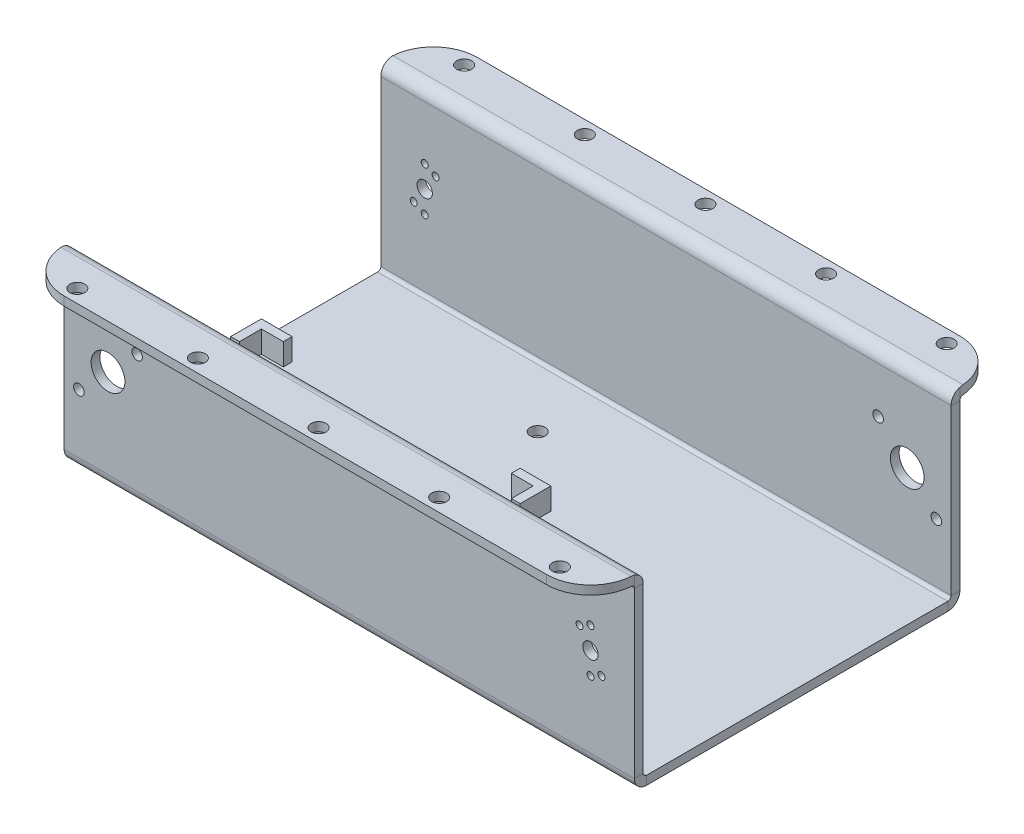
from build123d import *

# Parameters (mm, degrees)
SKETCH_1_W                         = 130
SKETCH_1_H                         = 74.2
SM_BASE_FLANGE_1_DEPTH             = 2
SM_EDGE_FLANGE_1_STRIP_W           = 9.4732
SM_EDGE_FLANGE_1_STRIP_H           = 2
SM_EDGE_FLANGE_1_STRIP_CUT_DEPTH   = 130
SM_EDGE_FLANGE_1_STRIP_2_W         = 9.4732
SM_EDGE_FLANGE_1_STRIP_2_H         = 2
SM_EDGE_FLANGE_1_STRIP_CUT_2_DEPTH = 130
SM_EDGE_FLANGE_1_DEPTH             = 130
SM_EDGE_FLANGE_1_BEND_DEPTH        = 130
SM_EDGE_FLANGE_2_STRIP_W           = 9.4732
SM_EDGE_FLANGE_2_STRIP_H           = 2
SM_EDGE_FLANGE_2_STRIP_CUT_DEPTH   = 130
SM_EDGE_FLANGE_2_STRIP_2_W         = 9.4732
SM_EDGE_FLANGE_2_STRIP_2_H         = 2
SM_EDGE_FLANGE_2_STRIP_CUT_2_DEPTH = 130
SM_EDGE_FLANGE_2_DEPTH             = 130
SM_EDGE_FLANGE_2_BEND_DEPTH        = 130
HOLE_WIZARD_M1_4_1_D               = 1.6
HOLE_WIZARD_M1_4_1_DEPTH           = 2
HOLE_WIZARD_M1_4_2_D               = 1.6
HOLE_WIZARD_M1_4_2_DEPTH           = 2
HOLE_WIZARD_3_5_3_5_1_D            = 3.5
HOLE_WIZARD_3_5_3_5_1_DEPTH        = 2
HOLE_WIZARD_3_5_3_5_2_D            = 3.5
HOLE_WIZARD_3_5_3_5_2_DEPTH        = 2
HOLE_WIZARD_7_7_7_7_1_D            = 7.7
HOLE_WIZARD_7_7_7_7_1_DEPTH        = 2
HOLE_WIZARD_7_7_7_7_2_D            = 7.7
HOLE_WIZARD_7_7_7_7_2_DEPTH        = 2
HOLE_WIZARD_M3_2_D                 = 3.4
EXTRUDE_1_DEPTH                    = 5
HOLE_WIZARD_M2_4_D                 = 2.4
HOLE_WIZARD_M2_4_DEPTH             = 2
HOLE_WIZARD_M2_5_D                 = 2.4
HOLE_WIZARD_M2_5_DEPTH             = 2
HOLE_WIZARD_M3_3_D                 = 3.4
HOLE_WIZARD_M3_3_DEPTH             = 1.978536948
HOLE_WIZARD_M3_3_TIP               = 1.021463052
FILLET_1_R                         = 10


# Sheet-metal steps are written as plain solids
with BuildPart() as part:
    # Sketch 1 → 基体-法兰1 (new body)
    with BuildSketch(Plane(origin=(0, 0, 0), x_dir=(1, 0, 0), z_dir=(0, 1, 0))):
        Rectangle(SKETCH_1_W, SKETCH_1_H)
    extrude(amount=-SM_BASE_FLANGE_1_DEPTH)

    # 边线-法兰1 strip (across the edge) → 边线-法兰1 strip cut (cut)
    with BuildSketch(Plane(origin=(-65, 0, 37.1), x_dir=(0, 0, -1), z_dir=(1, 0, 0))):
        with Locations((-2, -1)):
            Rectangle(SM_EDGE_FLANGE_1_STRIP_W, SM_EDGE_FLANGE_1_STRIP_H)
    extrude(amount=SM_EDGE_FLANGE_1_STRIP_CUT_DEPTH, mode=Mode.SUBTRACT)

    # 边线-法兰1 strip 2 (across the edge) → 边线-法兰1 strip cut 2 (cut)
    with BuildSketch(Plane(origin=(65, 0, -37.1), x_dir=(0, 0, 1), z_dir=(-1, 0, 0))):
        with Locations((-2, -1)):
            Rectangle(SM_EDGE_FLANGE_1_STRIP_2_W, SM_EDGE_FLANGE_1_STRIP_2_H)
    extrude(amount=SM_EDGE_FLANGE_1_STRIP_CUT_2_DEPTH, mode=Mode.SUBTRACT)

    # 边线-法兰1 section (across the edge) → 边线-法兰1 (add)
    with BuildSketch(Plane(origin=(-65, 0, 37.1), x_dir=(0, 0, -1), z_dir=(1, 0, 0))):
        with BuildLine():
            Line((0, 0.7366), (0, 41))
            Line((0, 41), (2, 41))
            Line((2, 41), (2, 0.7366))
            ThreePointArc((2, 0.7366), (2.215745145, 0.215745145), (2.7366, 0))
            Line((2.7366, 0), (2.7366, -2))
            ThreePointArc((2.7366, -2), (0.801531583, -1.198468417), (0, 0.7366))
        make_face()
    extrude(amount=SM_EDGE_FLANGE_1_DEPTH)

    # 边线-法兰1 section 2 (across the edge) → 边线-法兰1 bend (add)
    with BuildSketch(Plane(origin=(65, 0, -37.1), x_dir=(0, 0, 1), z_dir=(-1, 0, 0))):
        with BuildLine():
            Line((0, 0.7366), (0, 41))
            Line((0, 41), (2, 41))
            Line((2, 41), (2, 0.7366))
            ThreePointArc((2, 0.7366), (2.215745145, 0.215745145), (2.7366, 0))
            Line((2.7366, 0), (2.7366, -2))
            ThreePointArc((2.7366, -2), (0.801531583, -1.198468417), (0, 0.7366))
        make_face()
    extrude(amount=SM_EDGE_FLANGE_1_BEND_DEPTH)

    # 边线-法兰2 strip (across the edge) → 边线-法兰2 strip cut (cut)
    with BuildSketch(Plane(origin=(65, 41, 37.1), x_dir=(0, -1, 0), z_dir=(-1, 0, 0))):
        with Locations((-2, -1)):
            Rectangle(SM_EDGE_FLANGE_2_STRIP_W, SM_EDGE_FLANGE_2_STRIP_H)
    extrude(amount=SM_EDGE_FLANGE_2_STRIP_CUT_DEPTH, mode=Mode.SUBTRACT)

    # 边线-法兰2 strip 2 (across the edge) → 边线-法兰2 strip cut 2 (cut)
    with BuildSketch(Plane(origin=(-65, 41, -37.1), x_dir=(0, -1, 0), z_dir=(1, 0, 0))):
        with Locations((-2, -1)):
            Rectangle(SM_EDGE_FLANGE_2_STRIP_2_W, SM_EDGE_FLANGE_2_STRIP_2_H)
    extrude(amount=SM_EDGE_FLANGE_2_STRIP_CUT_2_DEPTH, mode=Mode.SUBTRACT)

    # 边线-法兰2 section (across the edge) → 边线-法兰2 (add)
    with BuildSketch(Plane(origin=(65, 41, 37.1), x_dir=(0, -1, 0), z_dir=(-1, 0, 0))):
        with BuildLine():
            Line((0, 0.7366), (0, 10))
            Line((0, 10), (2, 10))
            Line((2, 10), (2, 0.7366))
            ThreePointArc((2, 0.7366), (2.215745145, 0.215745145), (2.7366, 0))
            Line((2.7366, 0), (2.7366, -2))
            ThreePointArc((2.7366, -2), (0.801531583, -1.198468417), (0, 0.7366))
        make_face()
    extrude(amount=SM_EDGE_FLANGE_2_DEPTH)

    # 边线-法兰2 section 2 (across the edge) → 边线-法兰2 bend (add)
    with BuildSketch(Plane(origin=(-65, 41, -37.1), x_dir=(0, -1, 0), z_dir=(1, 0, 0))):
        with BuildLine():
            Line((0, 0.7366), (0, 10))
            Line((0, 10), (2, 10))
            Line((2, 10), (2, 0.7366))
            ThreePointArc((2, 0.7366), (2.215745145, 0.215745145), (2.7366, 0))
            Line((2.7366, 0), (2.7366, -2))
            ThreePointArc((2.7366, -2), (0.801531583, -1.198468417), (0, 0.7366))
        make_face()
    extrude(amount=SM_EDGE_FLANGE_2_BEND_DEPTH)

    # M1.4 间隙孔1
    with Locations(Plane(origin=(0, 0, -37.1), x_dir=(-1, 0, 0), z_dir=(0, 0, -1))):
        with Locations((52.5, 24.75), (55, 26), (57.5, 17.25), (55, 16)):
            Hole(HOLE_WIZARD_M1_4_1_D / 2, depth=HOLE_WIZARD_M1_4_1_DEPTH)

    # M1.4 间隙孔2
    with Locations(Plane.XY.offset(37.1)):
        with Locations((52.5, 24.75), (55, 26), (57.5, 17.25), (55, 16)):
            Hole(HOLE_WIZARD_M1_4_2_D / 2, depth=HOLE_WIZARD_M1_4_2_DEPTH)

    # Ø3.5 (3.5) 直径孔1
    with Locations(Plane(origin=(0, 0, -37.1), x_dir=(-1, 0, 0), z_dir=(0, 0, -1))):
        with Locations((55, 21)):
            Hole(HOLE_WIZARD_3_5_3_5_1_D / 2, depth=HOLE_WIZARD_3_5_3_5_1_DEPTH)

    # Ø3.5 (3.5) 直径孔2
    with Locations(Plane.XY.offset(37.1)):
        with Locations((55, 21)):
            Hole(HOLE_WIZARD_3_5_3_5_2_D / 2, depth=HOLE_WIZARD_3_5_3_5_2_DEPTH)

    # Ø7.7 (7.7) 直径孔1
    with Locations(Plane(origin=(0, 0, -37.1), x_dir=(-1, 0, 0), z_dir=(0, 0, -1))):
        with Locations((-55, 21)):
            Hole(HOLE_WIZARD_7_7_7_7_1_D / 2, depth=HOLE_WIZARD_7_7_7_7_1_DEPTH)

    # Ø7.7 (7.7) 直径孔2
    with Locations(Plane.XY.offset(37.1)):
        with Locations((-55, 21)):
            Hole(HOLE_WIZARD_7_7_7_7_2_D / 2, depth=HOLE_WIZARD_7_7_7_7_2_DEPTH)

    # M3 间隙孔2 (through all)
    with Locations(Plane(origin=(0, 41, 0), x_dir=(1, 0, 0), z_dir=(0, 1, 0))):
        with Locations((-55, 44.1), (-27.5, 44.1), (27.5, 44.1), (55, 44.1), (55, -44.1), (27.5, -44.1), (0, -44.1), (-27.5, -44.1), (-55, -44.1), (0, 44.1)):
            Hole(HOLE_WIZARD_M3_2_D / 2)

    # 草图46 → 凸台-拉伸1 (add)
    with BuildSketch(Plane(origin=(0, 0, 0), x_dir=(1, 0, 0), z_dir=(0, 1, 0))):
        Polygon((1.974724409, 6.87), (-5.025275591, 6.87), (-5.025275591, 4.87), (-0.025275591, 4.87), (-0.025275591, -0.13), (1.974724409, -0.13), align=None)
        Polygon((-64, 6.87), (-64, -0.13), (-62, -0.13), (-62, 4.87), (-57, 4.87), (-57, 6.87), align=None)
    extrude(amount=EXTRUDE_1_DEPTH)

    # M2 间隙孔4
    with Locations(Plane(origin=(0, 0, -37.1), x_dir=(-1, 0, 0), z_dir=(0, 0, -1))):
        with Locations((-48.366748111, 27.800733003), (-61.633251889, 14.199266997)):
            Hole(HOLE_WIZARD_M2_4_D / 2, depth=HOLE_WIZARD_M2_4_DEPTH)

    # M2 间隙孔5
    with Locations(Plane(origin=(0, 0, 35.1), x_dir=(-1, 0, 0), z_dir=(0, 0, -1))):
        with Locations((48.366748111, 27.800733003), (61.633251889, 14.199266997)):
            Hole(HOLE_WIZARD_M2_5_D / 2, depth=HOLE_WIZARD_M2_5_DEPTH)

    # M3 间隙孔3
    with Locations(Plane(origin=(0, 0, 0), x_dir=(1, 0, 0), z_dir=(0, 1, 0))):
        with Locations((-15.23, 21.09)):
            Hole(HOLE_WIZARD_M3_3_D / 2, depth=HOLE_WIZARD_M3_3_DEPTH)
            with Locations((0, 0, -(HOLE_WIZARD_M3_3_DEPTH + HOLE_WIZARD_M3_3_TIP / 2))):  # 118° drill point
                Cone(0, HOLE_WIZARD_M3_3_D / 2, HOLE_WIZARD_M3_3_TIP, mode=Mode.SUBTRACT)

    # 圆角1
    fillet_1_edges = [part.edges().sort_by_distance(p)[0] for p in [
        (65, 40, -47.1),
        (65, 40, 47.1),
        (-65, 40, 47.1),
        (-65, 40, -47.1),
    ]]
    fillet(fillet_1_edges, radius=FILLET_1_R - 0.0001)  # a hair under: the kernel refuses the full size


solid = part.part
